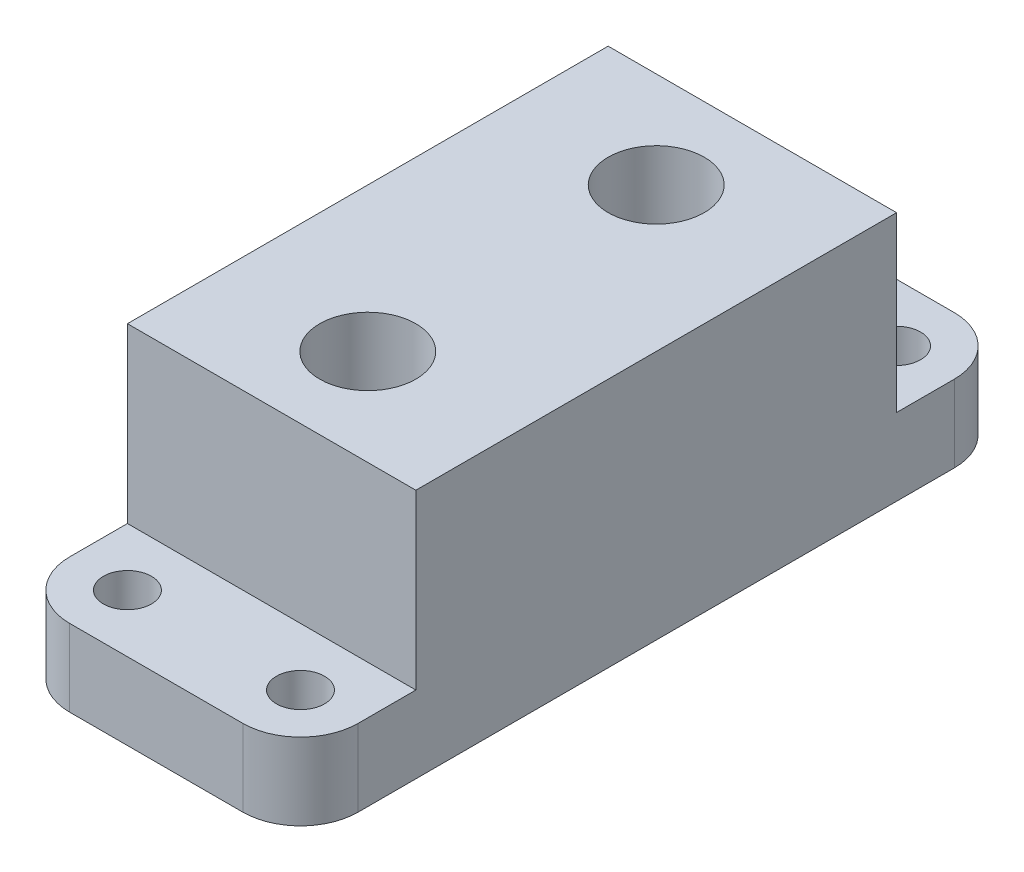
from build123d import *

# Parameters (mm, degrees)
SKETCH_1_W          = 65
SKETCH_1_H          = 25
EXTRUDE_1_DEPTH     = 4
SKETCH_2_W          = 15
SKETCH_2_H          = 25
EXTRUDE_2_DEPTH     = 13
SKETCH_3_R          = 2.5
SKETCH_3_R_2        = 4
CUT_EXTRUDE_1_DEPTH = 39.74919354
SKETCH_5_W          = 15
SKETCH_5_H          = 4
EXTRUDE_3_DEPTH     = 6
SKETCH_6_R          = 1.25
CUT_EXTRUDE_3_DEPTH = 40.59166579
FILLET_2_R          = 3
CUT_EXTRUDE_4_DEPTH = 49.023431781


with BuildPart() as part:
    # 草图1 → 凸台-拉伸1 (new body)
    with BuildSketch(Plane(origin=(0, 0, 0), x_dir=(1, 0, 0), z_dir=(0, 1, 0))):
        Rectangle(SKETCH_1_W, SKETCH_1_H)
    extrude(amount=EXTRUDE_1_DEPTH)

    # 草图2 → 凸台-拉伸2 (add)
    with BuildSketch(Plane(origin=(0, 4, 0), x_dir=(1, 0, 0), z_dir=(0, 1, 0))):
        Rectangle(SKETCH_2_W, SKETCH_2_H)
    extrude(amount=EXTRUDE_2_DEPTH)

    # 草图3 → 切除-拉伸1 (cut, through all)
    with BuildSketch(Plane.XZ):
        with Locations((0, -7.5)):
            Circle(SKETCH_3_R)
        with Locations((0, 7.5)):
            Circle(SKETCH_3_R)
        with Locations((-22, 0)):
            Circle(SKETCH_3_R_2)
        with Locations((22, 0)):
            Circle(SKETCH_3_R_2)
    extrude(amount=-CUT_EXTRUDE_1_DEPTH, mode=Mode.SUBTRACT)

    # 草图5 → 凸台-拉伸3 (add)
    with BuildSketch(Plane.XY.offset(12.5)):
        with Locations((0, 6)):
            Rectangle(SKETCH_5_W, SKETCH_5_H)
    extrude_3 = extrude(amount=EXTRUDE_3_DEPTH)

    # 草图6 → 切除-拉伸3 (cut, through all)
    with BuildSketch(Plane.XZ.offset(-4)):
        with Locations((-4.5, 15.5)):
            Circle(SKETCH_6_R)
        with Locations((4.5, 15.5)):
            Circle(SKETCH_6_R)
    cut_extrude_3 = extrude(amount=-CUT_EXTRUDE_3_DEPTH, mode=Mode.SUBTRACT)

    # 镜向2: 凸台-拉伸3, 切除-拉伸3 across plane
    add(extrude_3.mirror(Plane.XY))
    add(cut_extrude_3.mirror(Plane.XY), mode=Mode.SUBTRACT)

    # 圆角2
    fillet_2_edges = [part.edges().sort_by_distance(p)[0] for p in [
        (-7.5, 6, -18.5),
        (7.5, 6, -18.5),
        (-7.5, 6, 18.5),
        (7.5, 6, 18.5),
    ]]
    fillet(fillet_2_edges, radius=FILLET_2_R)

    # 草图7 → 切除-拉伸4 (cut, through all)
    with BuildSketch(Plane(origin=(0, 0, -12.5), x_dir=(-1, 0, 0), z_dir=(0, 0, -1))):
        Polygon((32.5, 4), (7.5, 4), (-7.5, 4), (-32.5, 4), (-32.5, 0), (32.5, 0), align=None)
    extrude(amount=-CUT_EXTRUDE_4_DEPTH, mode=Mode.SUBTRACT)


solid = part.part
